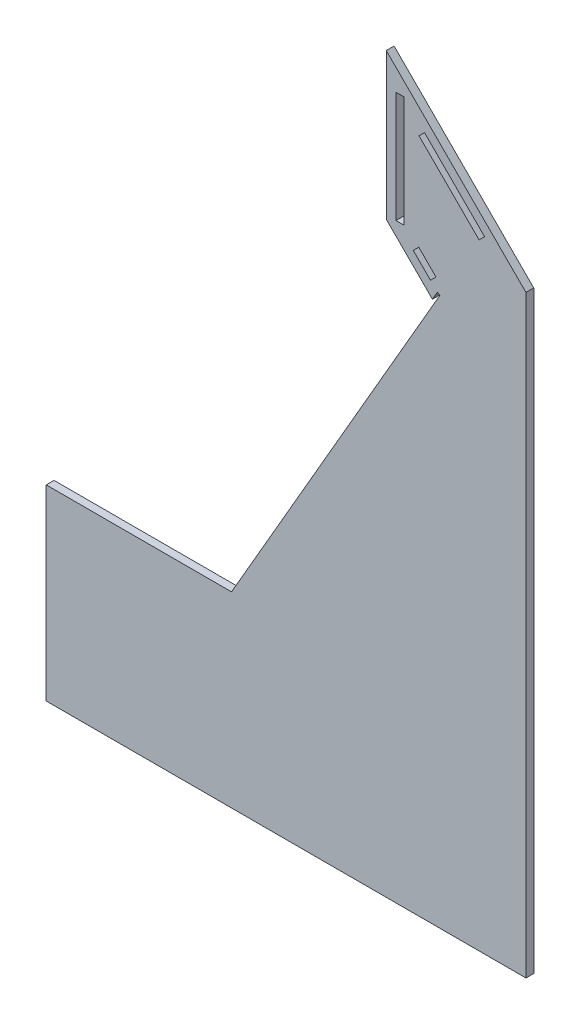
from build123d import *

# Parameters (mm, degrees)
SKETCH1_W           = 8
SKETCH1_H           = 113.93
BOSS_EXTRUDE1_DEPTH = 8


with BuildPart() as part:
    # Sketch1 → Boss-Extrude1 (new body)
    with BuildSketch(Plane.XY):
        Polygon((0, 192), (0, 0), (492, 0), (492, 608.949580676), (348.752525317, 752.197055359), (348.752525317, 602.197055359), (396.053847577, 554.895733099), (401.154700559, 563.730669624), (403.75277677, 562.230669624), (398.25, 552.699580676), (190, 192), align=None)
        with Locations((362.728293687, 663.122076496)):
            Rectangle(SKETCH1_W, SKETCH1_H, mode=Mode.SUBTRACT)
        Polygon((394.083632747, 570.801737436), (376.405963217, 588.479406966), (382.062817466, 594.136261215), (399.740486996, 576.458591686), align=None, mode=Mode.SUBTRACT)
        Polygon((443.916069922, 631.585591762), (382.284642873, 693.21701881), (387.941497123, 698.87387306), (449.572924171, 637.242446012), align=None, mode=Mode.SUBTRACT)
    extrude(amount=BOSS_EXTRUDE1_DEPTH)


solid = part.part
